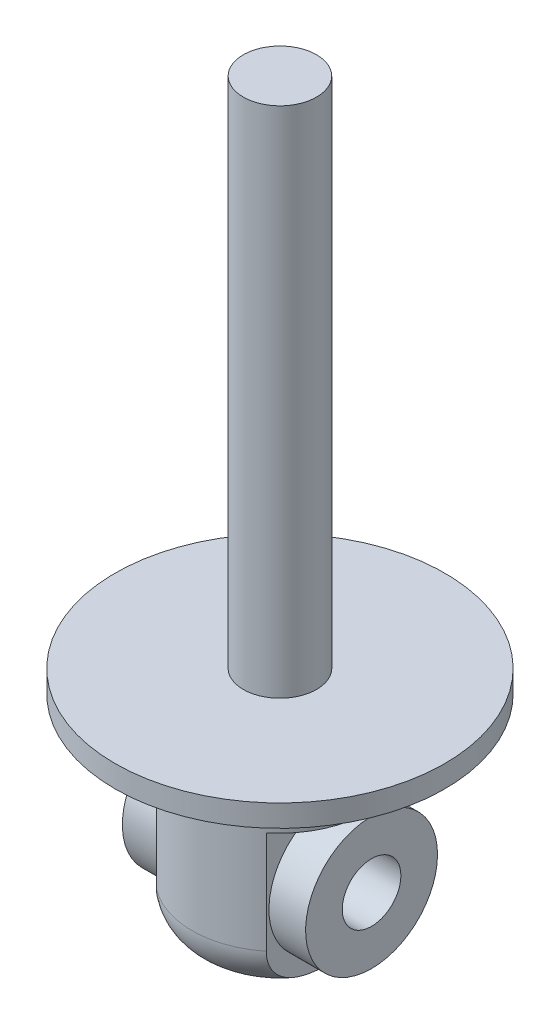
from build123d import *

# Parameters (mm, degrees)
SKETCH1_R               = 22.5
BOSS_EXTRUDE1_DEPTH     = 3
SKETCH2_R               = 5
BOSS_EXTRUDE2_DEPTH     = 70
SKETCH3_R               = 12
BOSS_EXTRUDE3_DEPTH     = 28
CUT_EXTRUDE1_DEPTH      = 80.633535649
CUT_EXTRUDE1_DEPTH_BACK = 80.633535649
SKETCH4_W               = 12.026752758
SKETCH4_H               = 20
FILLET1_R               = 6
CUT_EXTRUDE3_DEPTH      = 83.068568892
CUT_EXTRUDE3_DEPTH_BACK = 83.068568892
SKETCH6_R               = 4
SKETCH9_R               = 9
SKETCH9_R_2             = 4
BOSS_EXTRUDE4_DEPTH     = 12.5


with BuildPart() as part:
    # Sketch1 → Boss-Extrude1 (new body)
    with BuildSketch(Plane(origin=(0, 0, 0), x_dir=(1, 0, 0), z_dir=(0, 1, 0))):
        with Locations(Location((0, 0, 0), (0, 0, 270))):
            Circle(SKETCH1_R)
    extrude(amount=BOSS_EXTRUDE1_DEPTH)

    # Sketch2 → Boss-Extrude2 (add)
    with BuildSketch(Plane(origin=(0, 3, 0), x_dir=(1, 0, 0), z_dir=(0, 1, 0))):
        with Locations(Location((0, 0, 0), (0, 0, 270))):
            Circle(SKETCH2_R)
    extrude(amount=BOSS_EXTRUDE2_DEPTH)

    # Sketch3 → Boss-Extrude3 (add)
    with BuildSketch(Plane.XZ):
        with Locations(Location((0, 0, 0), (0, 0, 270))):
            Circle(SKETCH3_R)
    extrude(amount=BOSS_EXTRUDE3_DEPTH)

    # Sketch4 → Cut-Extrude1 (cut, two sides: drawn at the far end of the back side and taken through both)
    with BuildSketch(Plane.XY.offset(-CUT_EXTRUDE1_DEPTH_BACK)):
        with Locations((13.513376379, -18)):
            Rectangle(SKETCH4_W, SKETCH4_H)
        with Locations((-13.513376379, -18)):
            Rectangle(SKETCH4_W, SKETCH4_H)
    extrude(amount=CUT_EXTRUDE1_DEPTH + CUT_EXTRUDE1_DEPTH_BACK, mode=Mode.SUBTRACT)

    # Fillet1
    # the kernel refuses this fillet: 6 mm, written as the material it takes off along each edge
    with BuildSketch(Plane(origin=(0, -28, 0), x_dir=(0.9377485647369962, 0, -0.3473148849872455), z_dir=(-0.3473148849872455, 0, -0.9377485647369962))) as fillet1_piece_1:
        with BuildLine():
            CenterArc((12 - FILLET1_R, -FILLET1_R), FILLET1_R, 0, 90)
            Line((12 - FILLET1_R, 0), (12, 0))
            Line((12, 0), (12, -FILLET1_R))
        make_face()
    revolve(axis=Axis((0, -28, 0), (0, -1, 0)), revolution_arc=220.646338322, mode=Mode.SUBTRACT)
    with BuildSketch(Plane(origin=(0, -28, 0), x_dir=(0, 0, -1), z_dir=(-1, 0, 0))) as fillet1_piece_2:
        with BuildLine():
            CenterArc((12 - FILLET1_R, -FILLET1_R), FILLET1_R, 0, 90)
            Line((12 - FILLET1_R, 0), (12, 0))
            Line((12, 0), (12, -FILLET1_R))
        make_face()
    revolve(axis=Axis((0, -28, 0), (0, -1, 0)), revolution_arc=110.307225346, mode=Mode.SUBTRACT)
    with BuildSketch(Plane(origin=(0, -28, 0), x_dir=(-0.9378451764605575, 0, 0.34705392230842963), z_dir=(0.34705392230842963, 0, 0.9378451764605575))) as fillet1_piece_3:
        with BuildLine():
            CenterArc((12 - FILLET1_R, -FILLET1_R), FILLET1_R, 0, 90)
            Line((12 - FILLET1_R, 0), (12, 0))
            Line((12, 0), (12, -FILLET1_R))
        make_face()
    revolve(axis=Axis((0, -28, 0), (0, -1, 0)), revolution_arc=110.307225346, mode=Mode.SUBTRACT)

    # Sketch6 → Cut-Extrude3 (cut, two sides: drawn at the far end of the back side and taken through both)
    with BuildSketch(Plane(origin=(7.5, 0, 0), x_dir=(0, 0, -1), z_dir=(1, 0, 0)).offset(-CUT_EXTRUDE3_DEPTH_BACK)):
        with Locations(Location((0, -18, 0), (0, 0, 90))):
            Circle(SKETCH6_R)
    extrude(amount=CUT_EXTRUDE3_DEPTH + CUT_EXTRUDE3_DEPTH_BACK, mode=Mode.SUBTRACT)

    # Sketch9 → Boss-Extrude4 (add, symmetric)
    with BuildSketch(Plane(origin=(0, 0, 0), x_dir=(0, 0, -1), z_dir=(1, 0, 0))):
        with Locations(Location((0, -17.234671311, 0), (0, 0, 90))):
            Circle(SKETCH9_R)
        with Locations((0, -17.234671311)):
            Circle(SKETCH9_R_2, mode=Mode.SUBTRACT)
    extrude(amount=BOSS_EXTRUDE4_DEPTH, both=True)


solid = part.part
